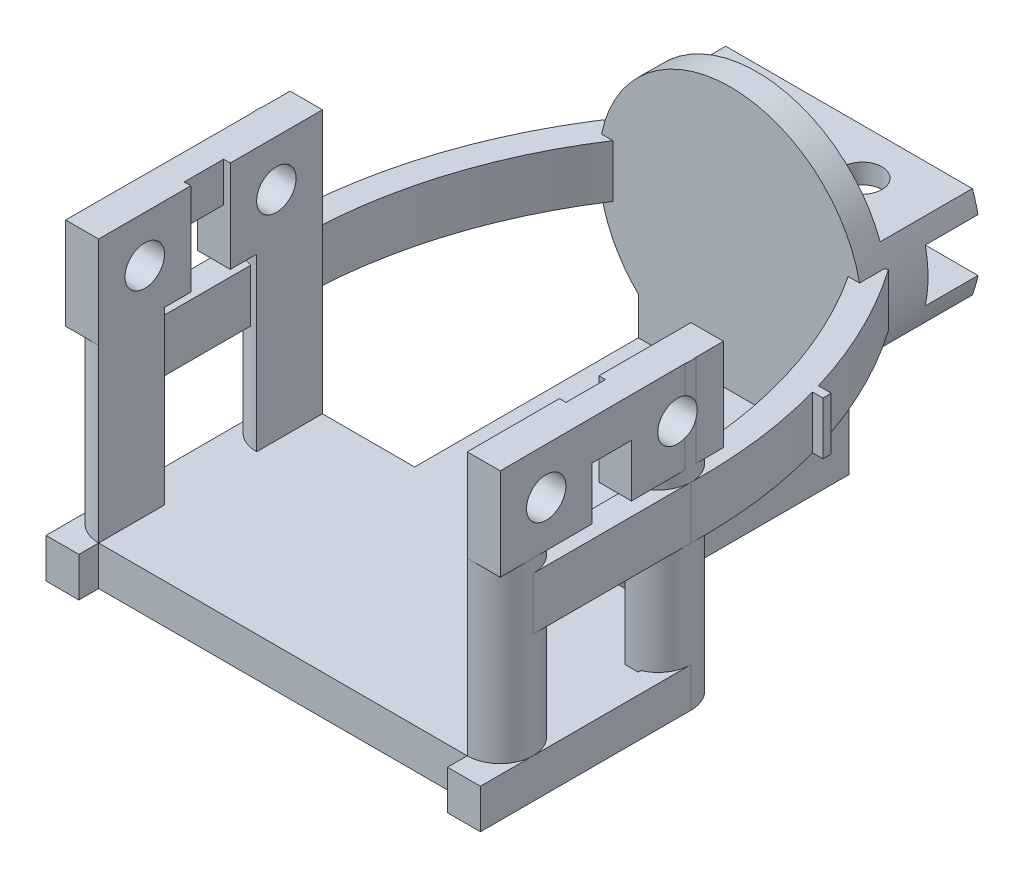
from build123d import *

# Parameters (mm, degrees)
BOSS_EXTRUDE1_DEPTH      = 10
BOSS_EXTRUDE2_START      = -1.5
BOSS_EXTRUDE2_DEPTH      = 1.5
SKETCH3_W                = 7
SKETCH3_H                = 1.5
BOSS_EXTRUDE3_DEPTH      = 9.5
SKETCH4_R                = 5
BOSS_EXTRUDE4_DEPTH      = 1
BOSS_EXTRUDE5_DEPTH      = 1
BOSS_EXTRUDE5_DEPTH_BACK = 1
BOSS_EXTRUDE7_START      = -1.5
BOSS_EXTRUDE7_DEPTH      = 1.5
BOSS_EXTRUDE9_DEPTH      = 0.75
BOSS_EXTRUDE9_DEPTH_BACK = 1.5
SKETCH11_W               = 1.25
SKETCH11_H               = 1.5
BOSS_EXTRUDE12_START     = 6.5
BOSS_EXTRUDE12_DEPTH     = 3.5
CUT_EXTRUDE9_DEPTH       = 2
CUT_EXTRUDE9_DEPTH_BACK  = 2
SKETCH16_3_R             = 0.75
BOSS_EXTRUDE13_REACH     = 24.842
SKETCH17_W               = 3.5
SKETCH17_H               = 3.5
SKETCH17_R               = 0.75
CUT_EXTRUDE10_DEPTH      = 2
CUT_EXTRUDE10_DEPTH_BACK = 3
SKETCH17_3_R             = 0.75
BOSS_EXTRUDE14_START     = 3.5
SKETCH18_W               = 4
SKETCH18_H               = 2
BOSS_EXTRUDE14_DEPTH     = 3.5
CUT_EXTRUDE11_DEPTH      = 21.827162
CUT_EXTRUDE11_DEPTH_BACK = 21.827162
SKETCH19_R               = 0.75
SKETCH20_W               = 1.680832
SKETCH20_H               = 2
CUT_EXTRUDE12_DEPTH      = 2


# Read off the part's stored shape, not the designer's step: Boss-Extrude12
with BuildPart() as part:
    # Sketch1 → Boss-Extrude1 (new body)
    with BuildSketch(Plane(origin=(0, 0, 0), x_dir=(1, 0, 0), z_dir=(0, 1, 0))):
        with BuildLine():
            ThreePointArc((-7.5, 1.854356), (-7.255387, 1.776367), (-7, 1.75))
            Line((-7, 1.75), (-7, 2.25))
            ThreePointArc((-7, 2.25), (-7.267617, 2.299371), (-7.5, 2.440983))
            Line((-7.5, 2.440983), (-7.5, 1.854356))
        make_face()
        with BuildLine():
            ThreePointArc((-7.5, 3.559017), (-7.267617, 3.700629), (-7, 3.75))
            Line((-7, 3.75), (-7, 4.25))
            ThreePointArc((-7, 4.25), (-7.255387, 4.223633), (-7.5, 4.145644))
            Line((-7.5, 4.145644), (-7.5, 3.559017))
        make_face()
        with BuildLine():
            ThreePointArc((-7.5, 2.440983), (-7.267617, 2.299371), (-7, 2.25))
            Line((-7, 2.25), (-7, 3.75))
            ThreePointArc((-7, 3.75), (-7.267617, 3.700629), (-7.5, 3.559017))
            Line((-7.5, 3.559017), (-7.5, 2.440983))
        make_face()
        with BuildLine():
            ThreePointArc((-8.25, 3), (-8.045825, 2.315347), (-7.5, 1.854356))
            Line((-7.5, 1.854356), (-7.5, 2.440983))
            ThreePointArc((-7.5, 2.440983), (-7.75, 3), (-7.5, 3.559017))
            Line((-7.5, 3.559017), (-7.5, 4.145644))
            ThreePointArc((-7.5, 4.145644), (-8.045825, 3.684653), (-8.25, 3))
        make_face()
        with BuildLine():
            Line((-7.5, -2.440983), (-7.5, -1.854356))
            ThreePointArc((-7.5, -1.854356), (-8.045825, -2.315347), (-8.25, -3))
            ThreePointArc((-8.25, -3), (-8.045825, -3.684653), (-7.5, -4.145644))
            Line((-7.5, -4.145644), (-7.5, -3.559017))
            ThreePointArc((-7.5, -3.559017), (-7.75, -3), (-7.5, -2.440983))
        make_face()
        with BuildLine():
            Line((-7, -2.25), (-7, -1.75))
            ThreePointArc((-7, -1.75), (-7.255387, -1.776367), (-7.5, -1.854356))
            Line((-7.5, -1.854356), (-7.5, -2.440983))
            ThreePointArc((-7.5, -2.440983), (-7.267617, -2.299371), (-7, -2.25))
        make_face()
        with BuildLine():
            Line((-7, -4.25), (-7, -3.75))
            ThreePointArc((-7, -3.75), (-7.267617, -3.700629), (-7.5, -3.559017))
            Line((-7.5, -3.559017), (-7.5, -4.145644))
            ThreePointArc((-7.5, -4.145644), (-7.255387, -4.223633), (-7, -4.25))
        make_face()
        with BuildLine():
            Line((-7, -3.75), (-7, -2.25))
            ThreePointArc((-7, -2.25), (-7.267617, -2.299371), (-7.5, -2.440983))
            Line((-7.5, -2.440983), (-7.5, -3.559017))
            ThreePointArc((-7.5, -3.559017), (-7.267617, -3.700629), (-7, -3.75))
        make_face()
        with BuildLine():
            Line((7, -2.25), (7, -3.75))
            ThreePointArc((7, -3.75), (7.267617, -3.700629), (7.5, -3.559017))
            Line((7.5, -3.559017), (7.5, -2.440983))
            ThreePointArc((7.5, -2.440983), (7.267617, -2.299371), (7, -2.25))
        make_face()
        with BuildLine():
            Line((7, -3.75), (7, -4.25))
            ThreePointArc((7, -4.25), (7.255387, -4.223633), (7.5, -4.145644))
            Line((7.5, -4.145644), (7.5, -3.559017))
            ThreePointArc((7.5, -3.559017), (7.267617, -3.700629), (7, -3.75))
        make_face()
        with BuildLine():
            ThreePointArc((7.5, -1.854356), (7.255387, -1.776367), (7, -1.75))
            Line((7, -1.75), (7, -2.25))
            ThreePointArc((7, -2.25), (7.267617, -2.299371), (7.5, -2.440983))
            Line((7.5, -2.440983), (7.5, -1.854356))
        make_face()
        with BuildLine():
            Line((7.5, -3.559017), (7.5, -4.145644))
            ThreePointArc((7.5, -4.145644), (8.045825, -3.684653), (8.25, -3))
            ThreePointArc((8.25, -3), (8.045825, -2.315347), (7.5, -1.854356))
            Line((7.5, -1.854356), (7.5, -2.440983))
            ThreePointArc((7.5, -2.440983), (7.684653, -2.693814), (7.75, -3))
            ThreePointArc((7.75, -3), (7.684653, -3.306186), (7.5, -3.559017))
        make_face()
        with BuildLine():
            ThreePointArc((7.5, 3.559017), (7.267617, 3.700629), (7, 3.75))
            Line((7, 3.75), (7, 2.25))
            ThreePointArc((7, 2.25), (7.267617, 2.299371), (7.5, 2.440983))
            Line((7.5, 2.440983), (7.5, 3.559017))
        make_face()
        with BuildLine():
            ThreePointArc((7.5, 4.145644), (7.255387, 4.223633), (7, 4.25))
            Line((7, 4.25), (7, 3.75))
            ThreePointArc((7, 3.75), (7.267617, 3.700629), (7.5, 3.559017))
            Line((7.5, 3.559017), (7.5, 4.145644))
        make_face()
        with BuildLine():
            Line((7, 2.25), (7, 1.75))
            ThreePointArc((7, 1.75), (7.255387, 1.776367), (7.5, 1.854356))
            Line((7.5, 1.854356), (7.5, 2.440983))
            ThreePointArc((7.5, 2.440983), (7.267617, 2.299371), (7, 2.25))
        make_face()
        with BuildLine():
            ThreePointArc((8.25, 3), (8.045825, 3.684653), (7.5, 4.145644))
            Line((7.5, 4.145644), (7.5, 3.559017))
            ThreePointArc((7.5, 3.559017), (7.684653, 3.306186), (7.75, 3))
            ThreePointArc((7.75, 3), (7.684653, 2.693814), (7.5, 2.440983))
            Line((7.5, 2.440983), (7.5, 1.854356))
            ThreePointArc((7.5, 1.854356), (8.045825, 2.315347), (8.25, 3))
        make_face()
    extrude(amount=BOSS_EXTRUDE1_DEPTH)

    # Sketch1<5> → Boss-Extrude2 (add)
    with BuildSketch(Plane(origin=(0, 0, 0), x_dir=(1, 0, 0), z_dir=(0, 1, 0)).offset(BOSS_EXTRUDE2_START)):
        with BuildLine():
            Line((-7, -1.75), (-7, 1.75))
            Line((-7, 1.75), (-7.5, 1.75))
            Line((-7.5, 1.75), (-7.5, 1.854356))
            ThreePointArc((-7.5, 1.854356), (-8.045825, 2.315347), (-8.25, 3))
            Line((-8.25, 3), (-8.25, -3))
            ThreePointArc((-8.25, -3), (-8.045825, -2.315347), (-7.5, -1.854356))
            Line((-7.5, -1.854356), (-7.5, -1.75))
            Line((-7.5, -1.75), (-7, -1.75))
        make_face()
        with BuildLine():
            ThreePointArc((-5.75, 3), (-6.116117, 2.116117), (-7, 1.75))
            Line((-7, 1.75), (-7, -1.75))
            ThreePointArc((-7, -1.75), (-6.116117, -2.116117), (-5.75, -3))
            ThreePointArc((-5.75, -3), (-6.116117, -3.883883), (-7, -4.25))
            Line((-7, -4.25), (7, -4.25))
            ThreePointArc((7, -4.25), (5.75, -3), (7, -1.75))
            Line((7, -1.75), (7, 1.75))
            ThreePointArc((7, 1.75), (5.75, 3), (7, 4.25))
            Line((7, 4.25), (-7, 4.25))
            ThreePointArc((-7, 4.25), (-6.116117, 3.883883), (-5.75, 3))
        make_face()
        with BuildLine():
            Line((-7, 2.25), (-7, 1.75))
            ThreePointArc((-7, 1.75), (-6.116117, 2.116117), (-5.75, 3))
            ThreePointArc((-5.75, 3), (-6.116117, 3.883883), (-7, 4.25))
            Line((-7, 4.25), (-7, 3.75))
            ThreePointArc((-7, 3.75), (-6.46967, 3.53033), (-6.25, 3))
            ThreePointArc((-6.25, 3), (-6.46967, 2.46967), (-7, 2.25))
        make_face()
        with BuildLine():
            ThreePointArc((-8.25, 3), (-8.045825, 2.315347), (-7.5, 1.854356))
            Line((-7.5, 1.854356), (-7.5, 2.440983))
            ThreePointArc((-7.5, 2.440983), (-7.75, 3), (-7.5, 3.559017))
            Line((-7.5, 3.559017), (-7.5, 4.145644))
            ThreePointArc((-7.5, 4.145644), (-8.045825, 3.684653), (-8.25, 3))
        make_face()
        with BuildLine():
            ThreePointArc((-7.5, 1.854356), (-7.255387, 1.776367), (-7, 1.75))
            Line((-7, 1.75), (-7, 2.25))
            ThreePointArc((-7, 2.25), (-7.267617, 2.299371), (-7.5, 2.440983))
            Line((-7.5, 2.440983), (-7.5, 1.854356))
        make_face()
        with BuildLine():
            ThreePointArc((-7.5, 3.559017), (-7.267617, 3.700629), (-7, 3.75))
            Line((-7, 3.75), (-7, 4.25))
            ThreePointArc((-7, 4.25), (-7.255387, 4.223633), (-7.5, 4.145644))
            Line((-7.5, 4.145644), (-7.5, 3.559017))
        make_face()
        with BuildLine():
            Line((-7, 3.75), (-7, 2.25))
            ThreePointArc((-7, 2.25), (-6.46967, 2.46967), (-6.25, 3))
            ThreePointArc((-6.25, 3), (-6.46967, 3.53033), (-7, 3.75))
        make_face()
        with BuildLine():
            ThreePointArc((-7.5, 2.440983), (-7.267617, 2.299371), (-7, 2.25))
            Line((-7, 2.25), (-7, 3.75))
            ThreePointArc((-7, 3.75), (-7.267617, 3.700629), (-7.5, 3.559017))
            Line((-7.5, 3.559017), (-7.5, 2.440983))
        make_face()
        with BuildLine():
            ThreePointArc((-7.5, 3.559017), (-7.75, 3), (-7.5, 2.440983))
            Line((-7.5, 2.440983), (-7.5, 3.559017))
        make_face()
        with BuildLine():
            Line((-7.5, -2.440983), (-7.5, -1.854356))
            ThreePointArc((-7.5, -1.854356), (-8.045825, -2.315347), (-8.25, -3))
            ThreePointArc((-8.25, -3), (-8.045825, -3.684653), (-7.5, -4.145644))
            Line((-7.5, -4.145644), (-7.5, -3.559017))
            ThreePointArc((-7.5, -3.559017), (-7.75, -3), (-7.5, -2.440983))
        make_face()
        with BuildLine():
            Line((-7, -2.25), (-7, -1.75))
            ThreePointArc((-7, -1.75), (-7.255387, -1.776367), (-7.5, -1.854356))
            Line((-7.5, -1.854356), (-7.5, -2.440983))
            ThreePointArc((-7.5, -2.440983), (-7.267617, -2.299371), (-7, -2.25))
        make_face()
        with BuildLine():
            Line((-7, -4.25), (-7, -3.75))
            ThreePointArc((-7, -3.75), (-7.267617, -3.700629), (-7.5, -3.559017))
            Line((-7.5, -3.559017), (-7.5, -4.145644))
            ThreePointArc((-7.5, -4.145644), (-7.255387, -4.223633), (-7, -4.25))
        make_face()
        with BuildLine():
            ThreePointArc((-6.25, -3), (-6.46967, -2.46967), (-7, -2.25))
            Line((-7, -2.25), (-7, -3.75))
            ThreePointArc((-7, -3.75), (-6.46967, -3.53033), (-6.25, -3))
        make_face()
        with BuildLine():
            Line((-7, -3.75), (-7, -2.25))
            ThreePointArc((-7, -2.25), (-7.267617, -2.299371), (-7.5, -2.440983))
            Line((-7.5, -2.440983), (-7.5, -3.559017))
            ThreePointArc((-7.5, -3.559017), (-7.267617, -3.700629), (-7, -3.75))
        make_face()
        with BuildLine():
            Line((-7.5, -3.559017), (-7.5, -2.440983))
            ThreePointArc((-7.5, -2.440983), (-7.75, -3), (-7.5, -3.559017))
        make_face()
        with BuildLine():
            ThreePointArc((-5.75, -3), (-6.116117, -2.116117), (-7, -1.75))
            Line((-7, -1.75), (-7, -2.25))
            ThreePointArc((-7, -2.25), (-6.46967, -2.46967), (-6.25, -3))
            ThreePointArc((-6.25, -3), (-6.46967, -3.53033), (-7, -3.75))
            Line((-7, -3.75), (-7, -4.25))
            ThreePointArc((-7, -4.25), (-6.116117, -3.883883), (-5.75, -3))
        make_face()
        with BuildLine():
            ThreePointArc((-7.5, -1.854356), (-7.255387, -1.776367), (-7, -1.75))
            Line((-7, -1.75), (-7.5, -1.75))
            Line((-7.5, -1.75), (-7.5, -1.854356))
        make_face()
        with BuildLine():
            Line((-7.5, 1.75), (-7, 1.75))
            ThreePointArc((-7, 1.75), (-7.255387, 1.776367), (-7.5, 1.854356))
            Line((-7.5, 1.854356), (-7.5, 1.75))
        make_face()
        with BuildLine():
            Line((7.5, 1.75), (7, 1.75))
            Line((7, 1.75), (7, -1.75))
            Line((7, -1.75), (7.5, -1.75))
            Line((7.5, -1.75), (7.5, -1.854356))
            ThreePointArc((7.5, -1.854356), (8.045825, -2.315347), (8.25, -3))
            Line((8.25, -3), (8.25, 3))
            ThreePointArc((8.25, 3), (8.045825, 2.315347), (7.5, 1.854356))
            Line((7.5, 1.854356), (7.5, 1.75))
        make_face()
        with BuildLine():
            Line((7, -3.75), (7, -4.25))
            ThreePointArc((7, -4.25), (7.255387, -4.223633), (7.5, -4.145644))
            Line((7.5, -4.145644), (7.5, -3.559017))
            ThreePointArc((7.5, -3.559017), (7.267617, -3.700629), (7, -3.75))
        make_face()
        with BuildLine():
            ThreePointArc((7.5, -1.854356), (7.255387, -1.776367), (7, -1.75))
            Line((7, -1.75), (7, -2.25))
            ThreePointArc((7, -2.25), (7.267617, -2.299371), (7.5, -2.440983))
            Line((7.5, -2.440983), (7.5, -1.854356))
        make_face()
        with BuildLine():
            ThreePointArc((7, -1.75), (5.75, -3), (7, -4.25))
            Line((7, -4.25), (7, -3.75))
            ThreePointArc((7, -3.75), (6.25, -3), (7, -2.25))
            Line((7, -2.25), (7, -1.75))
        make_face()
        with BuildLine():
            Line((7.5, -3.559017), (7.5, -4.145644))
            ThreePointArc((7.5, -4.145644), (8.045825, -3.684653), (8.25, -3))
            ThreePointArc((8.25, -3), (8.045825, -2.315347), (7.5, -1.854356))
            Line((7.5, -1.854356), (7.5, -2.440983))
            ThreePointArc((7.5, -2.440983), (7.684653, -2.693814), (7.75, -3))
            ThreePointArc((7.75, -3), (7.684653, -3.306186), (7.5, -3.559017))
        make_face()
        with BuildLine():
            Line((7, -2.25), (7, -3.75))
            ThreePointArc((7, -3.75), (7.267617, -3.700629), (7.5, -3.559017))
            Line((7.5, -3.559017), (7.5, -2.440983))
            ThreePointArc((7.5, -2.440983), (7.267617, -2.299371), (7, -2.25))
        make_face()
        with BuildLine():
            Line((7.5, -2.440983), (7.5, -3.559017))
            ThreePointArc((7.5, -3.559017), (7.684653, -3.306186), (7.75, -3))
            ThreePointArc((7.75, -3), (7.684653, -2.693814), (7.5, -2.440983))
        make_face()
        with BuildLine():
            ThreePointArc((7, -2.25), (6.25, -3), (7, -3.75))
            Line((7, -3.75), (7, -2.25))
        make_face()
        with BuildLine():
            Line((7.5, -1.75), (7, -1.75))
            ThreePointArc((7, -1.75), (7.255387, -1.776367), (7.5, -1.854356))
            Line((7.5, -1.854356), (7.5, -1.75))
        make_face()
        with BuildLine():
            ThreePointArc((8.25, 3), (8.045825, 3.684653), (7.5, 4.145644))
            Line((7.5, 4.145644), (7.5, 3.559017))
            ThreePointArc((7.5, 3.559017), (7.684653, 3.306186), (7.75, 3))
            ThreePointArc((7.75, 3), (7.684653, 2.693814), (7.5, 2.440983))
            Line((7.5, 2.440983), (7.5, 1.854356))
            ThreePointArc((7.5, 1.854356), (8.045825, 2.315347), (8.25, 3))
        make_face()
        with BuildLine():
            Line((7, 3.75), (7, 4.25))
            ThreePointArc((7, 4.25), (5.75, 3), (7, 1.75))
            Line((7, 1.75), (7, 2.25))
            ThreePointArc((7, 2.25), (6.25, 3), (7, 3.75))
        make_face()
        with BuildLine():
            ThreePointArc((7.5, 4.145644), (7.255387, 4.223633), (7, 4.25))
            Line((7, 4.25), (7, 3.75))
            ThreePointArc((7, 3.75), (7.267617, 3.700629), (7.5, 3.559017))
            Line((7.5, 3.559017), (7.5, 4.145644))
        make_face()
        with BuildLine():
            Line((7, 2.25), (7, 1.75))
            ThreePointArc((7, 1.75), (7.255387, 1.776367), (7.5, 1.854356))
            Line((7.5, 1.854356), (7.5, 2.440983))
            ThreePointArc((7.5, 2.440983), (7.267617, 2.299371), (7, 2.25))
        make_face()
        with BuildLine():
            ThreePointArc((7.5, 3.559017), (7.267617, 3.700629), (7, 3.75))
            Line((7, 3.75), (7, 2.25))
            ThreePointArc((7, 2.25), (7.267617, 2.299371), (7.5, 2.440983))
            Line((7.5, 2.440983), (7.5, 3.559017))
        make_face()
        with BuildLine():
            Line((7, 2.25), (7, 3.75))
            ThreePointArc((7, 3.75), (6.25, 3), (7, 2.25))
        make_face()
        with BuildLine():
            ThreePointArc((7.75, 3), (7.684653, 3.306186), (7.5, 3.559017))
            Line((7.5, 3.559017), (7.5, 2.440983))
            ThreePointArc((7.5, 2.440983), (7.684653, 2.693814), (7.75, 3))
        make_face()
    extrude(amount=BOSS_EXTRUDE2_DEPTH)

    # Sketch3 → Boss-Extrude3 (add)
    with BuildSketch(Plane(origin=(0, 0, -4.25), x_dir=(-1, 0, 0), z_dir=(0, 0, -1))):
        with Locations((0, -0.75)):
            Rectangle(SKETCH3_W, SKETCH3_H)
    extrude(amount=BOSS_EXTRUDE3_DEPTH)

    # Sketch4 → Boss-Extrude4 (add)
    with BuildSketch(Plane(origin=(0, 0, -13.75), x_dir=(-1, 0, 0), z_dir=(0, 0, -1))):
        with Locations((0, 5)):
            Circle(SKETCH4_R)
        with BuildLine():
            ThreePointArc((3.5, 1.429286), (1.890295, 0.371092), (0, 0))
            Line((0, 0), (3.5, 0))
            Line((3.5, 0), (3.5, 1.429286))
        make_face()
        with BuildLine():
            Line((-3.5, 1.429286), (-3.5, 0))
            Line((-3.5, 0), (0, 0))
            ThreePointArc((0, 0), (-1.890295, 0.371092), (-3.5, 1.429286))
        make_face()
        Polygon((0, 0), (-3.5, 0), (-3.5, -1.5), (3.5, -1.5), (3.5, 0), align=None)
    extrude(amount=-BOSS_EXTRUDE4_DEPTH)

    # Sketch5 → Boss-Extrude5 (add, two sides: drawn at the far end of the back side and taken through both)
    with BuildSketch(Plane(origin=(0, 5, 0), x_dir=(1, 0, 0), z_dir=(0, 1, 0)).offset(-BOSS_EXTRUDE5_DEPTH_BACK)):
        with BuildLine():
            ThreePointArc((-4.180836, 13.176441), (-6.527635, 8.345564), (-7.25028, 3.023663))
            Line((-7.25028, 3.023663), (-8.25, 3))
            ThreePointArc((-8.25, 3), (-7.484846, 8.634953), (-5, 13.75))
            Line((-5, 13.75), (-4.180836, 13.176441))
        make_face()
        with BuildLine():
            Line((5, 13.75), (4.180836, 13.176441))
            ThreePointArc((4.180836, 13.176441), (6.527635, 8.345564), (7.25028, 3.023663))
            Line((7.25028, 3.023663), (8.25, 3))
            ThreePointArc((8.25, 3), (7.484846, 8.634953), (5, 13.75))
        make_face()
        Polygon((7.25028, -3), (7.25028, 3.023663), (8.25, 3), (8.25, -3), align=None)
        Polygon((-7.25028, -3), (-8.25, -3), (-8.25, 3), (-7.25028, 3.023663), align=None)
        with BuildLine():
            ThreePointArc((5.453916, 13.069292), (5.230826, 13.412225), (5, 13.75))
            Line((5, 13.75), (4.551765, 13.436157))
            Line((4.551765, 13.436157), (5, 12.75))
            ThreePointArc((5, 12.75), (5.2297, 12.905747), (5.453916, 13.069292))
        make_face()
        with BuildLine():
            Line((-4.551765, 13.436157), (-5, 13.75))
            ThreePointArc((-5, 13.75), (-5.230826, 13.412225), (-5.453916, 13.069292))
            ThreePointArc((-5.453916, 13.069292), (-5.2297, 12.905747), (-5, 12.75))
            Line((-5, 12.75), (-4.551765, 13.436157))
        make_face()
        Polygon((7.498422, 8.589834), (7.59028, 8.272536), (7.983716, 8.272536), (7.983716, 8.589834), align=None)
    extrude(amount=BOSS_EXTRUDE5_DEPTH + BOSS_EXTRUDE5_DEPTH_BACK)

    # Sketch7 → Boss-Extrude7 (add)
    with BuildSketch(Plane(origin=(0, 10, 0), x_dir=(1, 0, 0), z_dir=(0, 1, 0)).offset(BOSS_EXTRUDE7_START)):
        with BuildLine():
            ThreePointArc((-7.25028, 1.775312), (-7.899332, 2.13184), (-8.232751, 2.79306))
            Line((-8.232751, 2.79306), (-8.25, -3))
            Line((-8.25, -3), (-7.25028, -3))
            Line((-7.25028, -3), (-7.25028, 1.775312))
        make_face()
        Polygon((7.25028, -3), (7.25028, 3.023663), (8.232622, 2.836568), (8.25, -3), align=None)
    extrude(amount=BOSS_EXTRUDE7_DEPTH)

    # Sketch11 → Boss-Extrude9 (add, two sides: drawn at the far end of the back side and taken through both)
    with BuildSketch(Plane.XY.offset(4.25).offset(-BOSS_EXTRUDE9_DEPTH_BACK)):
        with Locations((-7.625, -0.75)):
            Rectangle(SKETCH11_W, SKETCH11_H)
        with Locations((7.625, -0.75)):
            Rectangle(SKETCH11_W, SKETCH11_H)
    extrude(amount=BOSS_EXTRUDE9_DEPTH + BOSS_EXTRUDE9_DEPTH_BACK)

    # Boss-Extrude12 outline → Boss-Extrude12 (add)
    with BuildSketch(Plane(origin=(0, 0, 0), x_dir=(1, 0, 0), z_dir=(0, 1, 0)).offset(BOSS_EXTRUDE12_START)):
        with BuildLine():
            ThreePointArc((-8.231497, 3.214278), (-7.804566, 3.956647), (-7, 4.25))
            Line((-7, 4.25), (-8.228413, 4.25))
            Line((-8.228413, 4.25), (-8.231497, 3.214278))
        make_face()
        with BuildLine():
            Line((-7, 0.75), (-7, 1.75))
            ThreePointArc((-7, 1.75), (-7.807411, 2.045753), (-8.232751, 2.79306))
            Line((-8.232751, 2.79306), (-8.238834, 0.75))
            Line((-8.238834, 0.75), (-7, 0.75))
        make_face()
        with BuildLine():
            ThreePointArc((-8.249994, -2.996278), (-7.882567, -2.114802), (-7, -1.75))
            Line((-7, -1.75), (-7, -0.75))
            Line((-7, -0.75), (-8.243301, -0.75))
            Line((-8.243301, -0.75), (-8.249994, -2.996278))
        make_face()
        with BuildLine():
            ThreePointArc((-7, -4.25), (-7.885198, -3.882567), (-8.249994, -2.996278))
            Line((-8.249994, -2.996278), (-8.253722, -4.25))
            Line((-8.253722, -4.25), (-7, -4.25))
        make_face()
        with BuildLine():
            Line((-7.5, -3.559017), (-7.5, -2.440983))
            ThreePointArc((-7.5, -2.440983), (-7.75, -3), (-7.5, -3.559017))
        make_face()
        with BuildLine():
            ThreePointArc((-7.5, 3.559017), (-7.75, 3), (-7.5, 2.440983))
            Line((-7.5, 2.440983), (-7.5, 3.559017))
        make_face()
    extrude(amount=BOSS_EXTRUDE12_DEPTH)

    # Sketch16<3> → Cut-Extrude9 (cut, two sides: drawn at the far end of the back side and taken through both)
    with BuildSketch(Plane(origin=(-7, 0, 0), x_dir=(0, 0, -1), z_dir=(1, 0, 0)).offset(-CUT_EXTRUDE9_DEPTH_BACK)):
        with Locations(Location((-2.5, 8.25, 0), (0, 0, 180))):
            Circle(SKETCH16_3_R)
        with Locations(Location((2.5, 8.25, 0), (0, 0, 293.000928))):
            Circle(SKETCH16_3_R)
    extrude(amount=CUT_EXTRUDE9_DEPTH + CUT_EXTRUDE9_DEPTH_BACK, mode=Mode.SUBTRACT)

    # Boss-Extrude13: up to this plane
    boss_extrude13_end = Plane(origin=(8.240994, 8.5, -0.024537), z_dir=(0.9999955673191335, 0, -0.0029774724321619656))
    # Sketch17 → Boss-Extrude13 (add, up to the surface)
    with BuildSketch(Plane.ZY.offset(-7), mode=Mode.PRIVATE) as boss_extrude13_sk1:
        with Locations((-2.5, 8.25)):
            Rectangle(SKETCH17_W, SKETCH17_H)
        with Locations(Location((-2.5, 8.25, 0), (0, 0, 246.999072))):
            Circle(SKETCH17_R, mode=Mode.SUBTRACT)
    boss_extrude13_tool1 = split(extrude(boss_extrude13_sk1.sketch, amount=-BOSS_EXTRUDE13_REACH, mode=Mode.PRIVATE), bisect_by=boss_extrude13_end, keep=Keep.BOTH, mode=Mode.PRIVATE)
    add(boss_extrude13_tool1.solids().sort_by_distance((7, 6.549497, -2.5))[0])
    # Sketch17 → Boss-Extrude13 (add, up to the surface)
    with BuildSketch(Plane.ZY.offset(-7), mode=Mode.PRIVATE) as boss_extrude13_sk2:
        with Locations(Location((-2.5, 8.25, 0), (0, 0, 246.999072))):
            Circle(SKETCH17_R)
    boss_extrude13_tool2 = split(extrude(boss_extrude13_sk2.sketch, amount=-BOSS_EXTRUDE13_REACH, mode=Mode.PRIVATE), bisect_by=boss_extrude13_end, keep=Keep.BOTH, mode=Mode.PRIVATE)
    add(boss_extrude13_tool2.solids().sort_by_distance((7, 8.25, -2.5))[0])
    # Sketch17 → Boss-Extrude13 (add, up to the surface)
    with BuildSketch(Plane.ZY.offset(-7), mode=Mode.PRIVATE) as boss_extrude13_sk3:
        Polygon((0.75, 10), (0.75, 6.5), (1.75, 6.5), (1.75, 8.25), (1.75, 10), align=None)
    boss_extrude13_tool3 = split(extrude(boss_extrude13_sk3.sketch, amount=-BOSS_EXTRUDE13_REACH, mode=Mode.PRIVATE), bisect_by=boss_extrude13_end, keep=Keep.BOTH, mode=Mode.PRIVATE)
    add(boss_extrude13_tool3.solids().sort_by_distance((7, 8.25, 1.25))[0])
    # Sketch17 → Boss-Extrude13 (add, up to the surface)
    with BuildSketch(Plane.ZY.offset(-7), mode=Mode.PRIVATE) as boss_extrude13_sk4:
        Polygon((1.75, 8.25), (1.75, 6.5), (4.25, 6.5), (4.25, 10), (1.75, 10), align=None)
        with BuildLine():
            ThreePointArc((3.25, 8.25), (2.5, 7.5), (1.75, 8.25))
            ThreePointArc((1.75, 8.25), (2.5, 9), (3.25, 8.25))
        make_face(mode=Mode.SUBTRACT)
    boss_extrude13_tool4 = split(extrude(boss_extrude13_sk4.sketch, amount=-BOSS_EXTRUDE13_REACH, mode=Mode.PRIVATE), bisect_by=boss_extrude13_end, keep=Keep.BOTH, mode=Mode.PRIVATE)
    add(boss_extrude13_tool4.solids().sort_by_distance((7, 7.375, 1.793012))[0])
    # Sketch17 → Boss-Extrude13 (add, up to the surface)
    with BuildSketch(Plane.ZY.offset(-7), mode=Mode.PRIVATE) as boss_extrude13_sk5:
        with Locations((2.5, 8.25)):
            Circle(SKETCH17_R)
    boss_extrude13_tool5 = split(extrude(boss_extrude13_sk5.sketch, amount=-BOSS_EXTRUDE13_REACH, mode=Mode.PRIVATE), bisect_by=boss_extrude13_end, keep=Keep.BOTH, mode=Mode.PRIVATE)
    add(boss_extrude13_tool5.solids().sort_by_distance((7, 8.25, 2.5))[0])

    # Sketch17<3> → Cut-Extrude10 (cut, two sides: drawn at the far end of the back side and taken through both)
    with BuildSketch(Plane.ZY.offset(-7).offset(-CUT_EXTRUDE10_DEPTH_BACK)):
        with Locations(Location((-2.5, 8.25, 0), (0, 0, 246.999072))):
            Circle(SKETCH17_3_R)
        with Locations((2.5, 8.25)):
            Circle(SKETCH17_3_R)
    extrude(amount=CUT_EXTRUDE10_DEPTH + CUT_EXTRUDE10_DEPTH_BACK, mode=Mode.SUBTRACT)

    # Sketch18 → Boss-Extrude14 (add)
    with BuildSketch(Plane(origin=(0, 0, -13.75), x_dir=(-1, 0, 0), z_dir=(0, 0, -1)).offset(BOSS_EXTRUDE14_START)):
        with BuildLine():
            ThreePointArc((-4.683748, 6.75), (-5, 5), (-4.683748, 3.25))
            Line((-4.683748, 3.25), (4.683748, 3.25))
            ThreePointArc((4.683748, 3.25), (5, 5), (4.683748, 6.75))
            Line((4.683748, 6.75), (-4.683748, 6.75))
        make_face()
        with Locations((2.25, 5)):
            Rectangle(SKETCH18_W, SKETCH18_H, mode=Mode.SUBTRACT)
        with Locations((-2.25, 5)):
            Rectangle(SKETCH18_W, SKETCH18_H, mode=Mode.SUBTRACT)
    extrude(amount=-BOSS_EXTRUDE14_DEPTH)

    # Sketch19 → Cut-Extrude11 (cut, two sides: drawn at the far end of the back side and taken through both)
    with BuildSketch(Plane(origin=(0, 6.75, 0), x_dir=(1, 0, 0), z_dir=(0, 1, 0)).offset(-CUT_EXTRUDE11_DEPTH_BACK)):
        with Locations(Location((-2.25, 15.5, 0), (0, 0, 270))):
            Circle(SKETCH19_R)
        with Locations(Location((2.25, 15.5, 0), (0, 0, 90))):
            Circle(SKETCH19_R)
    extrude(amount=CUT_EXTRUDE11_DEPTH + CUT_EXTRUDE11_DEPTH_BACK, mode=Mode.SUBTRACT)

    # Sketch20 → Cut-Extrude12 (cut)
    with BuildSketch(Plane(origin=(0, 0, -17.25), x_dir=(-1, 0, 0), z_dir=(0, 0, -1))):
        with Locations((4.530754, 5)):
            Rectangle(SKETCH20_W, SKETCH20_H)
        with Locations((-4.530754, 5)):
            Rectangle(SKETCH20_W, SKETCH20_H)
    extrude(amount=-CUT_EXTRUDE12_DEPTH, mode=Mode.SUBTRACT)


solid = part.part
